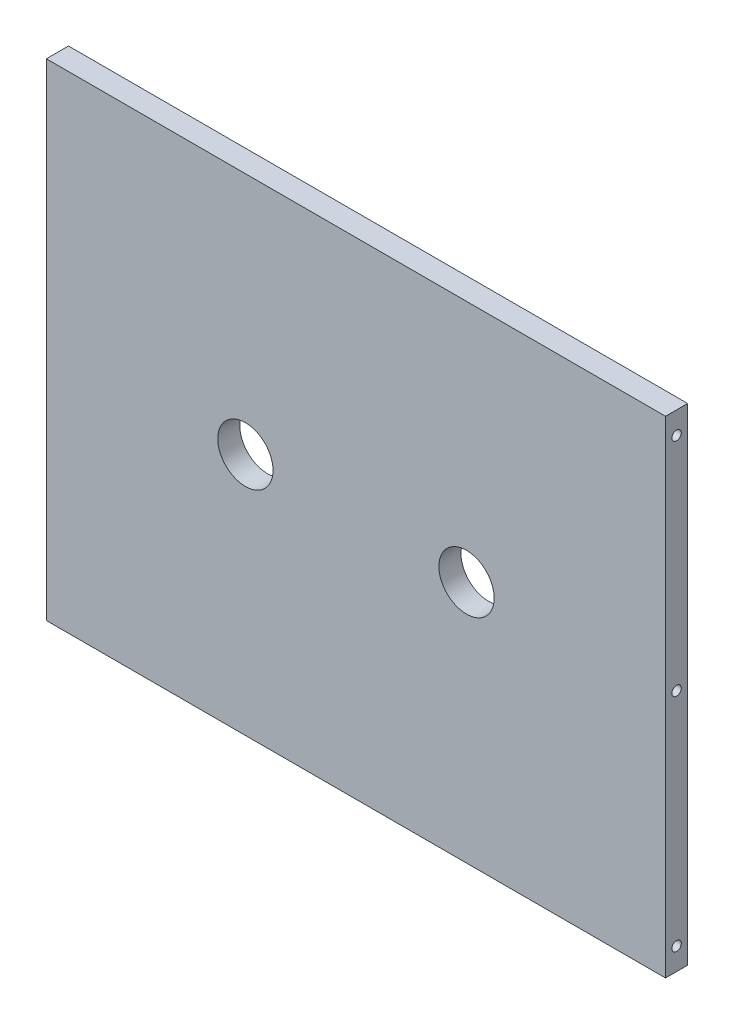
from build123d import *

# Parameters (mm, degrees)
SKETCH1_W                          = 177.8
SKETCH1_H                          = 139.7
BOSS_EXTRUDE1_DEPTH                = 6.35
SKETCH2_R                          = 7.9375
CUT_EXTRUDE1_DEPTH                 = 114.236721076
TAP_DRILL_FOR_6_32_TAP1_AT_2_COUNT = 2
TAP_DRILL_FOR_6_32_TAP1_AT_2_PITCH = 63.5
TAP_DRILL_FOR_6_32_TAP1_AT_3_COUNT = 2
TAP_DRILL_FOR_6_32_TAP1_AT_3_PITCH = 127


with BuildPart() as part:
    # Sketch1 → Boss-Extrude1 (new body)
    with BuildSketch(Plane.XY):
        Rectangle(SKETCH1_W, SKETCH1_H)
    extrude(amount=BOSS_EXTRUDE1_DEPTH)

    # Sketch2 → Cut-Extrude1 (cut, through all)
    with BuildSketch(Plane.XY.offset(6.35)):
        with Locations((-31.75, 0)):
            Circle(SKETCH2_R)
        with Locations((31.75, 0)):
            Circle(SKETCH2_R)
    extrude(amount=-CUT_EXTRUDE1_DEPTH, mode=Mode.SUBTRACT)

    # Sketch17 → Tap Drill for #6-32 Tap1 (revolve, cut)
    with BuildSketch(Plane(origin=(88.9, 63.5, 3.175), x_dir=(0, 0, -1), z_dir=(0, 1, 0))):
        Polygon((0, 0), (0, 13.51269403), (1.35255, 12.7), (1.35255, 0), align=None)
    tap_drill_for_6_32_tap1 = revolve(axis=Axis((95.25, 63.5, 3.175), (-1, 0, 0)), mode=Mode.SUBTRACT)

    # Tap Drill for #6-32 Tap1 at 2: Tap Drill for #6-32 Tap1 ×2
    with Locations(*[(0, -i * TAP_DRILL_FOR_6_32_TAP1_AT_2_PITCH, 0) for i in range(1, TAP_DRILL_FOR_6_32_TAP1_AT_2_COUNT)]):
        add(tap_drill_for_6_32_tap1, mode=Mode.SUBTRACT)

    # Tap Drill for #6-32 Tap1 at 3: Tap Drill for #6-32 Tap1 ×2
    with Locations(*[(0, -i * TAP_DRILL_FOR_6_32_TAP1_AT_3_PITCH, 0) for i in range(1, TAP_DRILL_FOR_6_32_TAP1_AT_3_COUNT)]):
        add(tap_drill_for_6_32_tap1, mode=Mode.SUBTRACT)

    # Mirror2: Tap Drill for #6-32 Tap1 across plane
    add(tap_drill_for_6_32_tap1.mirror(Plane(origin=(0, 0, 0), x_dir=(0, 0, 1), z_dir=(1, 0, 0))), mode=Mode.SUBTRACT)

    # Mirror2 copy 1 sketch → Mirror2 copy 1 (revolve, cut)
    with BuildSketch(Plane(origin=(-88.9, 0, 3.175), x_dir=(0, 0, -1), z_dir=(0, 1, 0))):
        Polygon((0, 0), (0, -13.51269403), (1.35255, -12.7), (1.35255, 0), align=None)
    revolve(axis=Axis((-95.25, 0, 3.175), (-1, 0, 0)), mode=Mode.SUBTRACT)

    # Mirror2 copy 2 sketch → Mirror2 copy 2 (revolve, cut)
    with BuildSketch(Plane(origin=(-88.9, -63.5, 3.175), x_dir=(0, 0, -1), z_dir=(0, 1, 0))):
        Polygon((0, 0), (0, -13.51269403), (1.35255, -12.7), (1.35255, 0), align=None)
    revolve(axis=Axis((-95.25, -63.5, 3.175), (-1, 0, 0)), mode=Mode.SUBTRACT)


solid = part.part
